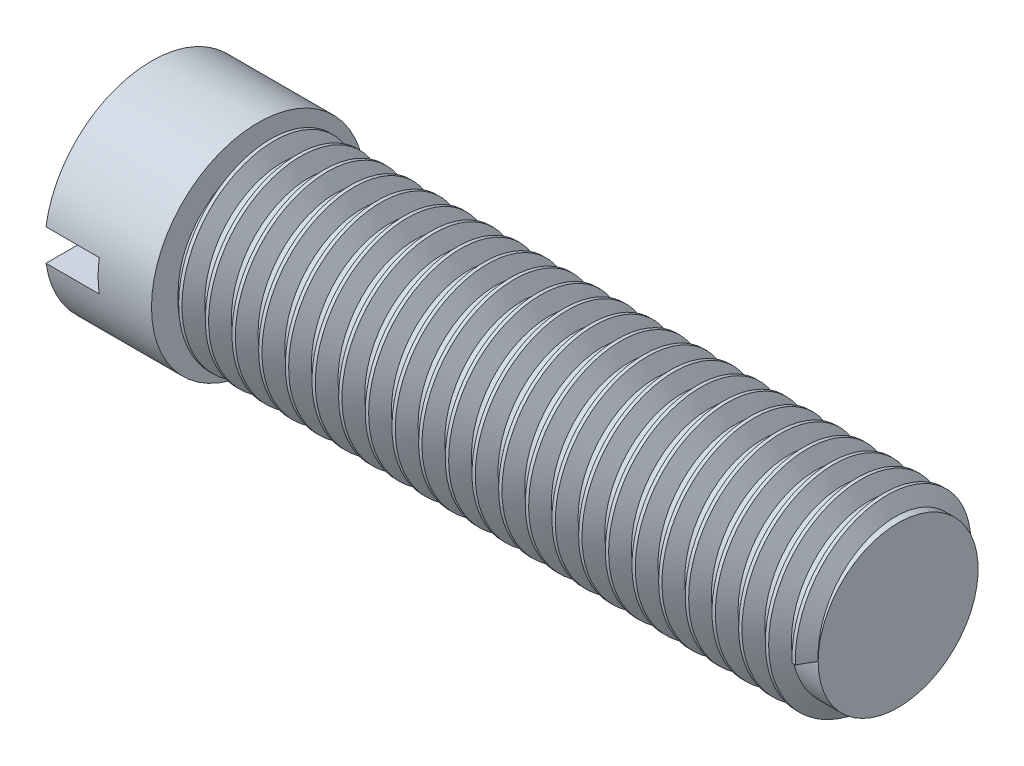
from build123d import *

# Parameters (mm, degrees)
CUT_EXTRUDE1_DEPTH      = 8.549834435
CUT_EXTRUDE1_DEPTH_BACK = 8.549834435
SKETCH2_W               = 2
SKETCH2_H               = 0.591729654
THREAD1_PITCH           = 0.5


with BuildPart() as part:
    # Sketch1 → Revolve1 (revolve)
    with BuildSketch(Plane.XY, mode=Mode.PRIVATE) as revolve1_sk:
        Polygon((-7, 0), (7, 0), (7, 1.5), (-5, 1.5), (-5, 2), (-7, 2), align=None)
    revolve(revolve1_sk.sketch.rotate(Axis((-7, 0, 0), (1, 0, 0)), 90), axis=Axis((-7, 0, 0), (1, 0, 0)))

    # Sketch2 → Cut-Extrude1 (cut, two sides: drawn at the far end of the back side and taken through both)
    with BuildSketch(Plane.XY.offset(-CUT_EXTRUDE1_DEPTH_BACK)):
        with Locations((-7, 0)):
            Rectangle(SKETCH2_W, SKETCH2_H)
    extrude(amount=CUT_EXTRUDE1_DEPTH + CUT_EXTRUDE1_DEPTH_BACK, mode=Mode.SUBTRACT)

    # Thread1: the profile of Thread Profile1 profile screwed along a right-hand helix of 24 turns, 6 arcs to a turn; built about Z, then put on its axis
    thread1_z = Axis((0, 0, 0), (0, 0, 1))
    thread1_corners = [(1.4997, 0, -0.000173205), (1.770632938, 0, 0.156249999), (1.770632937, 0, 0.218749999), (1.4997, 0, 0.375173204)]
    with BuildLine(mode=Mode.PRIVATE) as thread1_profile:
        Line(thread1_corners[0], thread1_corners[1])
        Line(thread1_corners[1], thread1_corners[2])
        Line(thread1_corners[2], thread1_corners[3])
        Line(thread1_corners[3], thread1_corners[0])
    thread1_cap = Face(thread1_profile.wire())
    thread1_turn_angles = [0, 30, 60, 90, 120, 150, 180, 210, 240, 270, 300, 330, 360]
    thread1_turn_weights = [1, 0.8660254037844387, 1, 0.8660254037844387, 1, 0.8660254037844387, 1, 0.8660254037844387, 1, 0.8660254037844387, 1, 0.8660254037844387, 1]
    thread1_turn_rails = [Edge.make_bspline([Vector(p[0], p[1], 0).rotate(thread1_z, thread1_turn_angles[k]) / thread1_turn_weights[k] + Vector(0, 0, p[2] + THREAD1_PITCH * thread1_turn_angles[k] / 360) for k in range(13)], [0, 0, 0, 1, 1, 2, 2, 3, 3, 4, 4, 5, 5, 6, 6, 6], 2, thread1_turn_weights) for p in thread1_corners]
    thread1_turn_sides = [Face.make_surface_from_curves(thread1_turn_rails[p[0]], thread1_turn_rails[p[1]]) for p in [(0, 1), (1, 2), (2, 3), (3, 0)]]
    thread1 = Plane(origin=(7, 0, 0), x_dir=(0, 0, 1), z_dir=(-1, 0, 0)) * Solid(Shell([*[p.moved(Location((0, 0, THREAD1_PITCH * i))) for i in range(24) for p in thread1_turn_sides], thread1_cap, thread1_cap.rotate(thread1_z, 8640).moved(Location((0, 0, THREAD1_PITCH * 8640 / 360)))]))
    add(thread1)


solid = part.part
